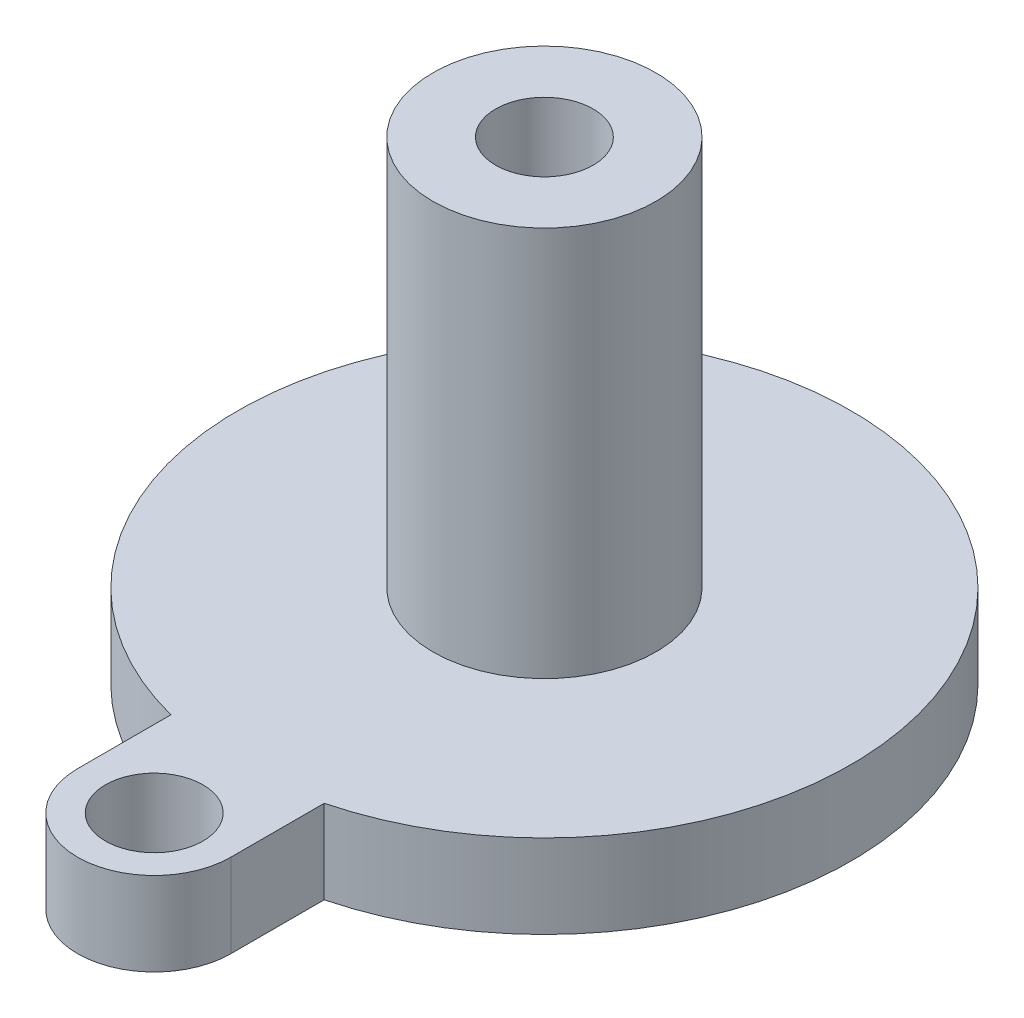
from build123d import *

# Parameters (mm, degrees)
SKETCH1_R           = 11
BOSS_EXTRUDE1_DEPTH = 3
SKETCH2_R           = 4
BOSS_EXTRUDE2_DEPTH = 14
SKETCH3_R           = 1.75
CUT_EXTRUDE1_DEPTH  = 20
SKETCH4_R           = 1.75
BOSS_EXTRUDE3_DEPTH = 3


with BuildPart() as part:
    # Sketch1 → Boss-Extrude1 (new body)
    with BuildSketch(Plane(origin=(0, 0, 0), x_dir=(1, 0, 0), z_dir=(0, 1, 0))):
        Circle(SKETCH1_R)
    extrude(amount=BOSS_EXTRUDE1_DEPTH)

    # Sketch2 → Boss-Extrude2 (add)
    with BuildSketch(Plane(origin=(0, 3, 0), x_dir=(1, 0, 0), z_dir=(0, 1, 0))):
        Circle(SKETCH2_R)
    extrude(amount=BOSS_EXTRUDE2_DEPTH)

    # Sketch3 → Cut-Extrude1 (cut)
    with BuildSketch(Plane(origin=(0, 17, 0), x_dir=(1, 0, 0), z_dir=(0, 1, 0))):
        Circle(SKETCH3_R)
    extrude(amount=-CUT_EXTRUDE1_DEPTH, mode=Mode.SUBTRACT)

    # Sketch4 → Boss-Extrude3 (add)
    with BuildSketch(Plane.XZ):
        with BuildLine():
            Line((2.75, 10.650704202), (2.75, 14))
            ThreePointArc((2.75, 14), (0, 16.75), (-2.75, 14))
            Line((-2.75, 14), (-2.75, 10.650704202))
            ThreePointArc((-2.75, 10.650704202), (0, 11), (2.75, 10.650704202))
        make_face()
        with Locations((0, 14)):
            Circle(SKETCH4_R, mode=Mode.SUBTRACT)
    extrude(amount=-BOSS_EXTRUDE3_DEPTH)


solid = part.part
